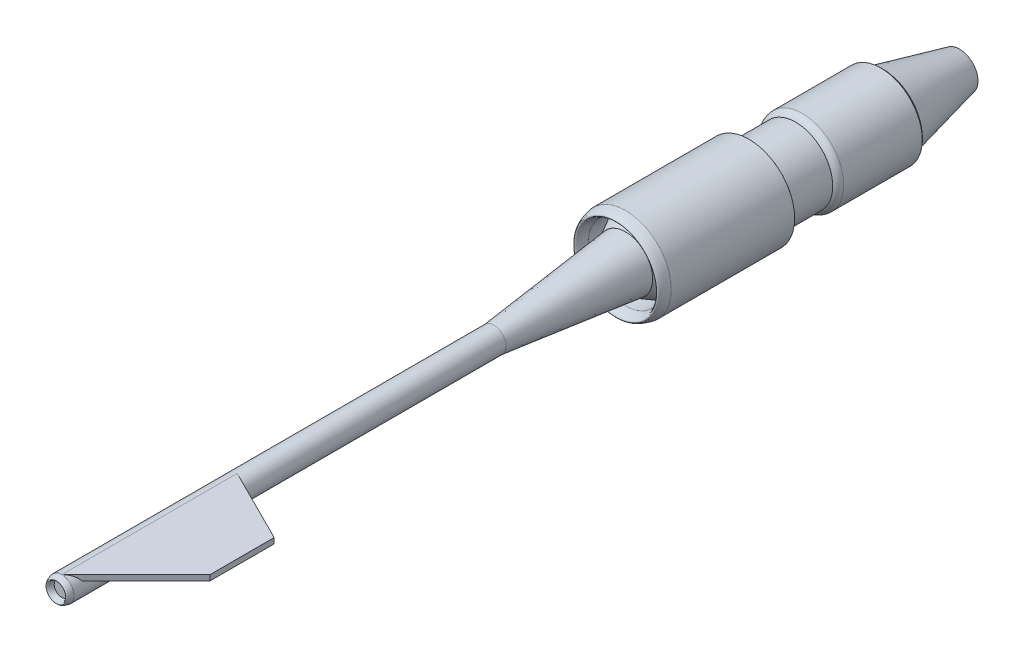
from build123d import *
from build123d.topology import SkipClean

# Parameters (mm, degrees)
SKETCH1_R           = 416.25
SKETCH1_R_2         = 337.5
BOSS_EXTRUDE1_DEPTH = 1125
SKETCH5_R           = 112.5
BOSS_EXTRUDE2_DEPTH = 3937.5
SKETCH15_R          = 337.5
BOSS_EXTRUDE5_DEPTH = 486
SKETCH16_R          = 376.875
BOSS_EXTRUDE6_DEPTH = 716
BOSS_EXTRUDE7_DEPTH = 50


with BuildPart() as part:
    # Sketch1 → Boss-Extrude1 (new body)
    with BuildSketch(Plane.XY):
        Circle(SKETCH1_R)
        Circle(SKETCH1_R_2, mode=Mode.SUBTRACT)
    extrude(amount=-BOSS_EXTRUDE1_DEPTH)

    # Sketch2 → Revolve1 (revolve)
    with BuildSketch(Plane(origin=(0, 0, 0), x_dir=(0, 0, -1), z_dir=(1, 0, 0))):
        with BuildLine():
            Line((0, 416.25), (0, 337.5))
            add(Edge.make_bspline(
                [(0, 337.5), (-180, 376.875), (0, 416.25)],
                knots=[0, 0, 0, 1, 1, 1], degree=2))
        make_face()
    revolve(axis=Axis((0, 0, 0), (0, 0, -1)))

    # Sketch18 → Revolve6 (revolve)
    with BuildSketch(Plane(origin=(0, 0, 0), x_dir=(0, 0, -1), z_dir=(1, 0, 0))):
        Polygon((0, 247.5), (306.632414301, 416.25), (306.632414301, 247.5), align=None)
    revolve(axis=Axis((0, 0, 0), (0, 0, -1)))



with BuildPart() as body_2:
    # Sketch4 → Revolve2 (revolve)
    with BuildSketch(Plane(origin=(0, 0, 0), x_dir=(1, 0, 0), z_dir=(0, 1, 0))):
        Polygon((0, 0), (0, -1200), (112.5, -1200), (247.5, 0), align=None)
    revolve(axis=Axis((0, 0, 0), (0, 0, 1)))

    # Sketch5 → Boss-Extrude2 (add)
    with BuildSketch(Plane.XY.offset(1200)):
        Circle(SKETCH5_R)
    extrude(amount=BOSS_EXTRUDE2_DEPTH)

    # Sketch14 → Revolve4 (revolve)
    with BuildSketch(Plane(origin=(0, 0, 0), x_dir=(0, 0, -1), z_dir=(1, 0, 0))):
        with BuildLine():
            Line((-5137.5, 90), (-5137.5, 112.5))
            add(Edge.make_bspline(
                [(-5137.5, 67.5), (-5237.5, 90), (-5137.5, 112.5)],
                knots=[0, 0, 0, 1, 1, 1], degree=2))
            Line((-5137.5, 67.5), (-5137.5, 90))
        make_face()
    revolve(axis=Axis((0, 0, 5137.5), (0, 0, 1)))

    # Sketch22 → Boss-Extrude7 (add)
    with BuildSketch(Plane(origin=(0, 112.486092048, 0), x_dir=(1, 0, 0), z_dir=(0, 1, 0))):
        Polygon((1.768925034, -3540), (1.768925034, -5137.5), (676.768925034, -4462.5), (676.768925034, -3877.5), align=None)
    extrude(amount=-BOSS_EXTRUDE7_DEPTH)


with BuildPart() as body_3:
    # Sketch15 → Boss-Extrude5 (new body)
    with BuildSketch(Plane(origin=(0, 0, -1125), x_dir=(-1, 0, 0), z_dir=(0, 0, -1))):
        Circle(SKETCH15_R)
    extrude(amount=BOSS_EXTRUDE5_DEPTH)

    # Sketch16 → Boss-Extrude6 (add)
    with BuildSketch(Plane(origin=(0, 0, -1611), x_dir=(-1, 0, 0), z_dir=(0, 0, -1))):
        Circle(SKETCH16_R)
    extrude(amount=BOSS_EXTRUDE6_DEPTH)

    # Sketch17 → Revolve5 (revolve)
    with BuildSketch(Plane(origin=(0, 0, 0), x_dir=(0, 0, -1), z_dir=(1, 0, 0))):
        Polygon((2327, 0), (3043, 0), (3043, 168.75), (2327, 337.5), align=None)
    revolve(axis=Axis((0, 0, -2327), (0, 0, -1)))

    # Sketch19 → Revolve9 (revolve)
    with BuildSketch(Plane(origin=(0, 0, 0), x_dir=(0, 0, -1), z_dir=(1, 0, 0))):
        with BuildLine():
            Line((1611, 337.5), (1551, 337.5))
            ThreePointArc((1551, 337.5), (1575.706535425, 365.253731733), (1611, 376.875))
            Line((1611, 376.875), (1611, 337.5))
        make_face()
    revolve(axis=Axis((0, 0, -1611), (0, 0, 1)))


with BuildPart() as part_1:
    with SkipClean():  # the faces are left unmerged after this step: merging them gives an invalid solid
        add(part.part)

        add(body_3.part)  # Revolve11 merges body 3
        # Sketch20 → Revolve11 (revolve)
        with BuildSketch(Plane(origin=(0, 0, 0), x_dir=(0, 0, -1), z_dir=(1, 0, 0))):
            with BuildLine():
                Line((1125, 337.5), (1125, 416.25))
                add(Edge.make_bspline(
                    [(1155, 337.5), (1155, 382.589285714), (1125, 416.25)],
                    knots=[0, 0, 0, 1, 1, 1], degree=2, weights=[1, 0.806097206, 1]))
                Line((1155, 337.5), (1125, 337.5))
            make_face()
        revolve(axis=Axis((0, 0, -1125), (0, 0, -1)))

    # Sketch21 → Revolve12 (revolve)
    with BuildSketch(Plane(origin=(0, 0, 0), x_dir=(0, 0, -1), z_dir=(1, 0, 0))):
        with BuildLine():
            Line((2327, 337.5), (2327, 376.875))
            add(Edge.make_bspline(
                [(2327, 376.875), (2356.199972531, 357.1875), (2356.199972531, 330.618023234)],
                knots=[0, 0, 0, 1, 1, 1], degree=2, weights=[1, 0.829833158, 1]))
            Line((2356.199972531, 330.618023234), (2327, 337.5))
        make_face()
    revolve(axis=Axis((0, 0, -2327), (0, 0, -1)))


solid = Compound([body_2.part, part_1.part])
